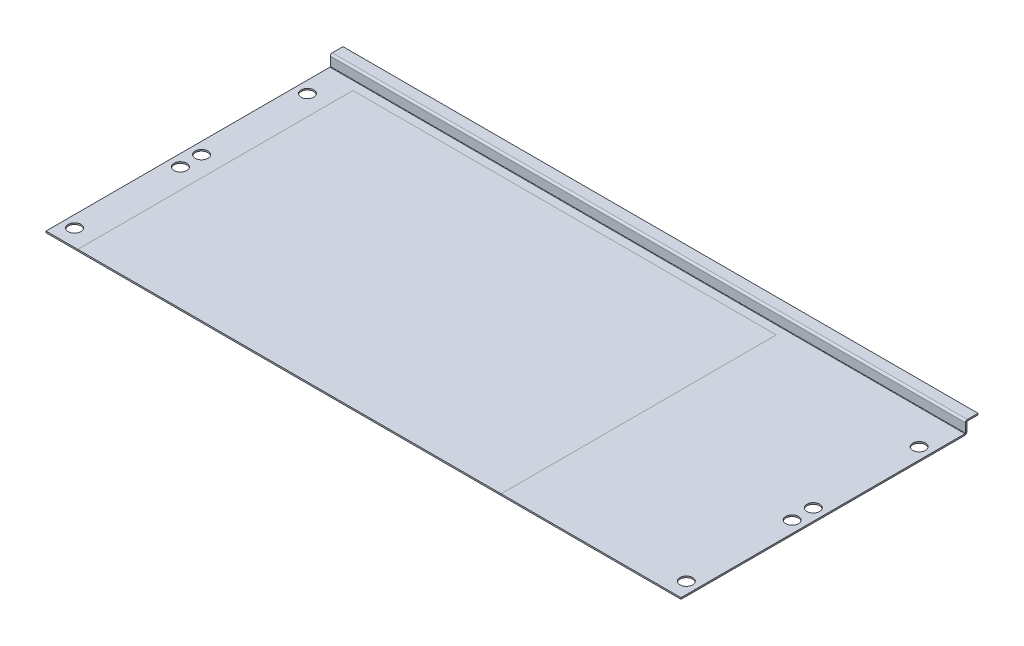
from build123d import *
from build123d.topology import SkipClean

# Parameters (mm, degrees)
SKETCH_1_W                       = 300
SKETCH_1_H                       = 135
SKETCH_1_R                       = 3
SM_BASE_FLANGE_1_DEPTH           = 0.7
SM_EDGE_FLANGE_1_STRIP_W         = 3.2
SM_EDGE_FLANGE_1_STRIP_H         = 0.7
SM_EDGE_FLANGE_1_STRIP_CUT_DEPTH = 300
SM_EDGE_FLANGE_1_DEPTH           = 300
SM_EDGE_FLANGE_2_STRIP_W         = 3.2
SM_EDGE_FLANGE_2_STRIP_H         = 0.7
SM_EDGE_FLANGE_2_STRIP_CUT_DEPTH = 300
SM_EDGE_FLANGE_2_DEPTH           = 300
MOVE_START                       = -0.5
MOVE_BODY_1_OUTLINE_W            = 300
MOVE_BODY_1_OUTLINE_H            = 134.3
MOVE_BODY_1_OUTLINE_R            = 3
MOVE_BODY_1_DEPTH                = 0.5
MOVE_START_2                     = -6
MOVE_BODY_1_2_OUTLINE_W          = 300
MOVE_BODY_1_2_OUTLINE_H          = 6
MOVE_BODY_1_2_DEPTH              = 4.6
MOVE_START_3                     = -1.343604
MOVE_BODY_1_3_OUTLINE_W          = 300
MOVE_BODY_1_3_OUTLINE_H          = 134.3
MOVE_BODY_1_3_OUTLINE_R          = 3
MOVE_BODY_1_3_DEPTH              = 0.643604
MOVE_BODY_1_4_OUTLINE_W          = 300
MOVE_BODY_1_4_OUTLINE_H          = 0.7
MOVE_BODY_1_4_DEPTH              = 4.2
MOVE_START_4                     = -1.4
MOVE_BODY_1_5_OUTLINE_W          = 300
MOVE_BODY_1_5_OUTLINE_H          = 134.3
MOVE_BODY_1_5_OUTLINE_R          = 3
MOVE_BODY_1_5_DEPTH              = 0.056396
MOVE_START_5                     = 3.7
MOVE_BODY_1_6_OUTLINE_W          = 300
MOVE_BODY_1_6_OUTLINE_H          = 6
MOVE_BODY_1_6_DEPTH              = 0.9
MOVE_START_6                     = -0.7
MOVE_BODY_1_7_OUTLINE_W          = 300
MOVE_BODY_1_7_OUTLINE_H          = 0.7
MOVE_BODY_1_7_DEPTH              = 0.2
MOVE_START_7                     = -151
MOVE_BODY_1_8_DEPTH              = 301
SPLIT_BODIES_1_SURFACE_1_BACK    = 332.24
SPLIT_BODIES_1_SURFACE_1_DEPTH   = 664.48
SPLIT_BODIES_1_SURFACE_2_BACK    = 332.24
SPLIT_BODIES_1_SURFACE_2_DEPTH   = 664.48


with BuildPart() as part:
    # 基体-法兰1: sheet metal written as solids
    # 草图1 → 基体-法兰1 (new body)
    with BuildSketch(Plane(origin=(0, 0, 0), x_dir=(1, 0, 0), z_dir=(0, 1, 0))):
        Rectangle(SKETCH_1_W, SKETCH_1_H)
        with Locations(Location((-144.5, -59.5, 0), (0, 0, 270))):
            Circle(SKETCH_1_R, mode=Mode.SUBTRACT)
        with Locations(Location((-144.5, -9.5, 0), (0, 0, 270))):
            Circle(SKETCH_1_R, mode=Mode.SUBTRACT)
        with Locations(Location((-144.5, 0.5, 0), (0, 0, 270))):
            Circle(SKETCH_1_R, mode=Mode.SUBTRACT)
        with Locations(Location((-144.5, 50.5, 0), (0, 0, 270))):
            Circle(SKETCH_1_R, mode=Mode.SUBTRACT)
        with Locations(Location((144.5, -59.5, 0), (0, 0, 90))):
            Circle(SKETCH_1_R, mode=Mode.SUBTRACT)
        with Locations(Location((144.5, -9.5, 0), (0, 0, 90))):
            Circle(SKETCH_1_R, mode=Mode.SUBTRACT)
        with Locations(Location((144.5, 0.5, 0), (0, 0, 90))):
            Circle(SKETCH_1_R, mode=Mode.SUBTRACT)
        with Locations(Location((144.5, 50.5, 0), (0, 0, 90))):
            Circle(SKETCH_1_R, mode=Mode.SUBTRACT)
    extrude(amount=-SM_BASE_FLANGE_1_DEPTH)

    # 边线-法兰1: sheet metal written as solids
    # 边线-法兰1 strip (on a plane across the edge) → 边线-法兰1 strip cut (cut)
    with BuildSketch(Plane(origin=(-150, -0.7, -67.5), x_dir=(0, 0, 1), z_dir=(1, 0, 0))):
        with Locations((-0.7, -0.35)):
            Rectangle(SM_EDGE_FLANGE_1_STRIP_W, SM_EDGE_FLANGE_1_STRIP_H)
    extrude(amount=SM_EDGE_FLANGE_1_STRIP_CUT_DEPTH, mode=Mode.SUBTRACT)

    # 边线-法兰1 section (on a plane across the edge) → 边线-法兰1 (add)
    with BuildSketch(Plane(origin=(-150, -0.7, -67.5), x_dir=(0, 0, 1), z_dir=(1, 0, 0))):
        with BuildLine():
            Line((0, 0.2), (0, 5.3))
            Line((0, 5.3), (0.7, 5.3))
            Line((0.7, 5.3), (0.7, 0.2))
            ThreePointArc((0.7, 0.2), (0.758578644, 0.058578644), (0.9, 0))
            Line((0.9, 0), (0.9, -0.7))
            ThreePointArc((0.9, -0.7), (0.263603897, -0.436396103), (0, 0.2))
        make_face()
    extrude(amount=SM_EDGE_FLANGE_1_DEPTH)

    # 边线-法兰2: sheet metal written as solids
    # 边线-法兰2 strip (on a plane across the edge) → 边线-法兰2 strip cut (cut)
    with BuildSketch(Plane(origin=(150, -6, -67.5), x_dir=(0, 1, 0), z_dir=(-1, 0, 0))):
        with Locations((-0.7, -0.35)):
            Rectangle(SM_EDGE_FLANGE_2_STRIP_W, SM_EDGE_FLANGE_2_STRIP_H)
    extrude(amount=SM_EDGE_FLANGE_2_STRIP_CUT_DEPTH, mode=Mode.SUBTRACT)

    # 边线-法兰2 section (on a plane across the edge) → 边线-法兰2 (add)
    with BuildSketch(Plane(origin=(150, -6, -67.5), x_dir=(0, 1, 0), z_dir=(-1, 0, 0))):
        with BuildLine():
            Line((0, 0.2), (0, 5.3))
            Line((0, 5.3), (0.7, 5.3))
            Line((0.7, 5.3), (0.7, 0.2))
            ThreePointArc((0.7, 0.2), (0.758578644, 0.058578644), (0.9, 0))
            Line((0.9, 0), (0.9, -0.7))
            ThreePointArc((0.9, -0.7), (0.263603897, -0.436396103), (0, 0.2))
        make_face()
    extrude(amount=SM_EDGE_FLANGE_2_DEPTH)

    # Move Body 1: read off the stored shape, not the designer's step
    # Move Body 1 outline → Move Body 1 (cut)
    with BuildSketch(Plane(origin=(0, 0, 0), x_dir=(1, 0, 0), z_dir=(0, 1, 0)).offset(MOVE_START)):
        with Locations((0, -0.35)):
            Rectangle(MOVE_BODY_1_OUTLINE_W, MOVE_BODY_1_OUTLINE_H)
        with Locations((-144.5, -59.5)):
            Circle(MOVE_BODY_1_OUTLINE_R, mode=Mode.SUBTRACT)
        with Locations((-144.5, -9.5)):
            Circle(MOVE_BODY_1_OUTLINE_R, mode=Mode.SUBTRACT)
        with Locations((-144.5, 0.5)):
            Circle(MOVE_BODY_1_OUTLINE_R, mode=Mode.SUBTRACT)
        with Locations((144.5, -59.5)):
            Circle(MOVE_BODY_1_OUTLINE_R, mode=Mode.SUBTRACT)
        with Locations((144.5, -9.5)):
            Circle(MOVE_BODY_1_OUTLINE_R, mode=Mode.SUBTRACT)
        with Locations((144.5, 0.5)):
            Circle(MOVE_BODY_1_OUTLINE_R, mode=Mode.SUBTRACT)
        with Locations((-144.5, 50.5)):
            Circle(MOVE_BODY_1_OUTLINE_R, mode=Mode.SUBTRACT)
        with Locations((144.5, 50.5)):
            Circle(MOVE_BODY_1_OUTLINE_R, mode=Mode.SUBTRACT)
    extrude(amount=MOVE_BODY_1_DEPTH, mode=Mode.SUBTRACT)

    # Move Body 1 2 outline → Move Body 1 2 (cut)
    with BuildSketch(Plane(origin=(0, 0, 0), x_dir=(1, 0, 0), z_dir=(0, 1, 0)).offset(MOVE_START_2)):
        with Locations((0, 69.8)):
            Rectangle(MOVE_BODY_1_2_OUTLINE_W, MOVE_BODY_1_2_OUTLINE_H)
    extrude(amount=MOVE_BODY_1_2_DEPTH, mode=Mode.SUBTRACT)

    # Move Body 1 3 outline → Move Body 1 3 (add)
    with SkipClean():  # the faces are left unmerged after this step: merging them gives an invalid solid
        with BuildSketch(Plane(origin=(0, 0, 0), x_dir=(1, 0, 0), z_dir=(0, 1, 0)).offset(MOVE_START_3)):
            with Locations((0, -0.35)):
                Rectangle(MOVE_BODY_1_3_OUTLINE_W, MOVE_BODY_1_3_OUTLINE_H)
            with Locations((-144.5, -59.5)):
                Circle(MOVE_BODY_1_3_OUTLINE_R, mode=Mode.SUBTRACT)
            with Locations((-144.5, -9.5)):
                Circle(MOVE_BODY_1_3_OUTLINE_R, mode=Mode.SUBTRACT)
            with Locations((-144.5, 0.5)):
                Circle(MOVE_BODY_1_3_OUTLINE_R, mode=Mode.SUBTRACT)
            with Locations((144.5, -59.5)):
                Circle(MOVE_BODY_1_3_OUTLINE_R, mode=Mode.SUBTRACT)
            with Locations((144.5, -9.5)):
                Circle(MOVE_BODY_1_3_OUTLINE_R, mode=Mode.SUBTRACT)
            with Locations((144.5, 0.5)):
                Circle(MOVE_BODY_1_3_OUTLINE_R, mode=Mode.SUBTRACT)
            with Locations((-144.5, 50.5)):
                Circle(MOVE_BODY_1_3_OUTLINE_R, mode=Mode.SUBTRACT)
            with Locations((144.5, 50.5)):
                Circle(MOVE_BODY_1_3_OUTLINE_R, mode=Mode.SUBTRACT)
        extrude(amount=MOVE_BODY_1_3_DEPTH)

    # Move Body 1 4 outline → Move Body 1 4 (add)
    with SkipClean():  # the faces are left unmerged after this step: merging them gives an invalid solid
        with BuildSketch(Plane(origin=(0, 0, 0), x_dir=(1, 0, 0), z_dir=(0, 1, 0)).offset(MOVE_START)):
            with Locations((0, 67.15)):
                Rectangle(MOVE_BODY_1_4_OUTLINE_W, MOVE_BODY_1_4_OUTLINE_H)
        extrude(amount=MOVE_BODY_1_4_DEPTH)

    # Move Body 1 5 outline → Move Body 1 5 (add)
    with SkipClean():  # the faces are left unmerged after this step: merging them gives an invalid solid
        with BuildSketch(Plane(origin=(0, 0, 0), x_dir=(1, 0, 0), z_dir=(0, 1, 0)).offset(MOVE_START_4)):
            with Locations((0, -0.35)):
                Rectangle(MOVE_BODY_1_5_OUTLINE_W, MOVE_BODY_1_5_OUTLINE_H)
            with Locations((-144.5, -59.5)):
                Circle(MOVE_BODY_1_5_OUTLINE_R, mode=Mode.SUBTRACT)
            with Locations((-144.5, -9.5)):
                Circle(MOVE_BODY_1_5_OUTLINE_R, mode=Mode.SUBTRACT)
            with Locations((-144.5, 0.5)):
                Circle(MOVE_BODY_1_5_OUTLINE_R, mode=Mode.SUBTRACT)
            with Locations((144.5, -59.5)):
                Circle(MOVE_BODY_1_5_OUTLINE_R, mode=Mode.SUBTRACT)
            with Locations((144.5, -9.5)):
                Circle(MOVE_BODY_1_5_OUTLINE_R, mode=Mode.SUBTRACT)
            with Locations((144.5, 0.5)):
                Circle(MOVE_BODY_1_5_OUTLINE_R, mode=Mode.SUBTRACT)
            with Locations((-144.5, 50.5)):
                Circle(MOVE_BODY_1_5_OUTLINE_R, mode=Mode.SUBTRACT)
            with Locations((144.5, 50.5)):
                Circle(MOVE_BODY_1_5_OUTLINE_R, mode=Mode.SUBTRACT)
        extrude(amount=MOVE_BODY_1_5_DEPTH)

    # Move Body 1 6 outline → Move Body 1 6 (add)
    with SkipClean():  # the faces are left unmerged after this step: merging them gives an invalid solid
        with BuildSketch(Plane(origin=(0, 0, 0), x_dir=(1, 0, 0), z_dir=(0, 1, 0)).offset(MOVE_START_5)):
            with Locations((0, 69.8)):
                Rectangle(MOVE_BODY_1_6_OUTLINE_W, MOVE_BODY_1_6_OUTLINE_H)
        extrude(amount=MOVE_BODY_1_6_DEPTH)

    # Move Body 1 7 outline → Move Body 1 7 (add)
    with SkipClean():  # the faces are left unmerged after this step: merging them gives an invalid solid
        with BuildSketch(Plane(origin=(0, 0, 0), x_dir=(1, 0, 0), z_dir=(0, 1, 0)).offset(MOVE_START_6)):
            with Locations((0, 67.15)):
                Rectangle(MOVE_BODY_1_7_OUTLINE_W, MOVE_BODY_1_7_OUTLINE_H)
        extrude(amount=MOVE_BODY_1_7_DEPTH)

    # Move Body 1 8 outline → Move Body 1 8 (cut)
    with BuildSketch(Plane.YZ.offset(MOVE_START_7)):
        with BuildLine():
            Line((-0.5, 67.5), (-0.7, 67.5))
            Line((-0.7, 67.5), (-0.7, -66.6))
            ThreePointArc((-0.7, -66.6), (-0.641421356, -66.741421356), (-0.5, -66.8))
            Line((-0.5, -66.8), (-0.5, 67.5))
        make_face()
        with BuildLine():
            ThreePointArc((-0.7, -67.477496439), (-1.203562364, -67.161248608), (-1.4, -66.6))
            Line((-1.4, -66.6), (-1.4, -67.5))
            Line((-1.4, -67.5), (-0.9, -67.5))
            ThreePointArc((-0.9, -67.5), (-0.799368978, -67.494356415), (-0.7, -67.477496439))
        make_face()
        with BuildLine():
            Line((4.6, -66.8), (3.7, -66.8))
            ThreePointArc((3.7, -66.8), (4.336396103, -67.063603897), (4.6, -67.7))
            Line((4.6, -67.7), (4.6, -66.8))
        make_face()
        with BuildLine():
            ThreePointArc((-0.5, -67.5), (-0.600631022, -67.494356415), (-0.7, -67.477496439))
            Line((-0.7, -67.477496439), (-0.7, -67.5))
            Line((-0.7, -67.5), (-0.5, -67.5))
        make_face()
        with BuildLine():
            ThreePointArc((3.9, -67.7), (3.841421356, -67.558578644), (3.7, -67.5))
            Line((3.7, -67.5), (3.7, -72.8))
            Line((3.7, -72.8), (3.9, -72.8))
            Line((3.9, -72.8), (3.9, -67.7))
        make_face()
    extrude(amount=MOVE_BODY_1_8_DEPTH, mode=Mode.SUBTRACT)


with BuildPart() as body_2:
    # Split Bodies 1: the piece behind the surface
    add(part.part)
    # Split Bodies 1 surface: a surface, the sketch's curves swept straight by 664.48 mm
    with BuildLine(Plane(origin=(0, -0.7, 0), x_dir=(1, 0, 0), z_dir=(0, 1, 0)).offset(-SPLIT_BODIES_1_SURFACE_1_BACK), mode=Mode.PRIVATE) as split_bodies_1_surface_1_path:
        Line((65, -67.5), (-135, -67.5))
        Line((-135, -67.5), (-135, 62.5))
        Line((-135, 62.5), (65, 62.5))
        Line((65, 62.5), (65, -67.5))
    split_bodies_1_surface_1 = Shell.extrude(split_bodies_1_surface_1_path.wire(), (0 * SPLIT_BODIES_1_SURFACE_1_DEPTH, 1 * SPLIT_BODIES_1_SURFACE_1_DEPTH, 0 * SPLIT_BODIES_1_SURFACE_1_DEPTH))
    split(bisect_by=split_bodies_1_surface_1, keep=Keep.BOTTOM)


with BuildPart() as part_1:
    add(part.part)

    # Split Bodies 1: split by a surface, the side it looks to stays
    # Split Bodies 1 surface: a surface, the sketch's curves swept straight by 664.48 mm
    with BuildLine(Plane(origin=(0, -0.7, 0), x_dir=(1, 0, 0), z_dir=(0, 1, 0)).offset(-SPLIT_BODIES_1_SURFACE_2_BACK), mode=Mode.PRIVATE) as split_bodies_1_surface_2_path:
        Line((65, -67.5), (-135, -67.5))
        Line((-135, -67.5), (-135, 62.5))
        Line((-135, 62.5), (65, 62.5))
        Line((65, 62.5), (65, -67.5))
    split_bodies_1_surface_2 = Shell.extrude(split_bodies_1_surface_2_path.wire(), (0 * SPLIT_BODIES_1_SURFACE_2_DEPTH, 1 * SPLIT_BODIES_1_SURFACE_2_DEPTH, 0 * SPLIT_BODIES_1_SURFACE_2_DEPTH))
    split(bisect_by=split_bodies_1_surface_2, keep=Keep.TOP)


solid = Compound([body_2.part, part_1.part])
